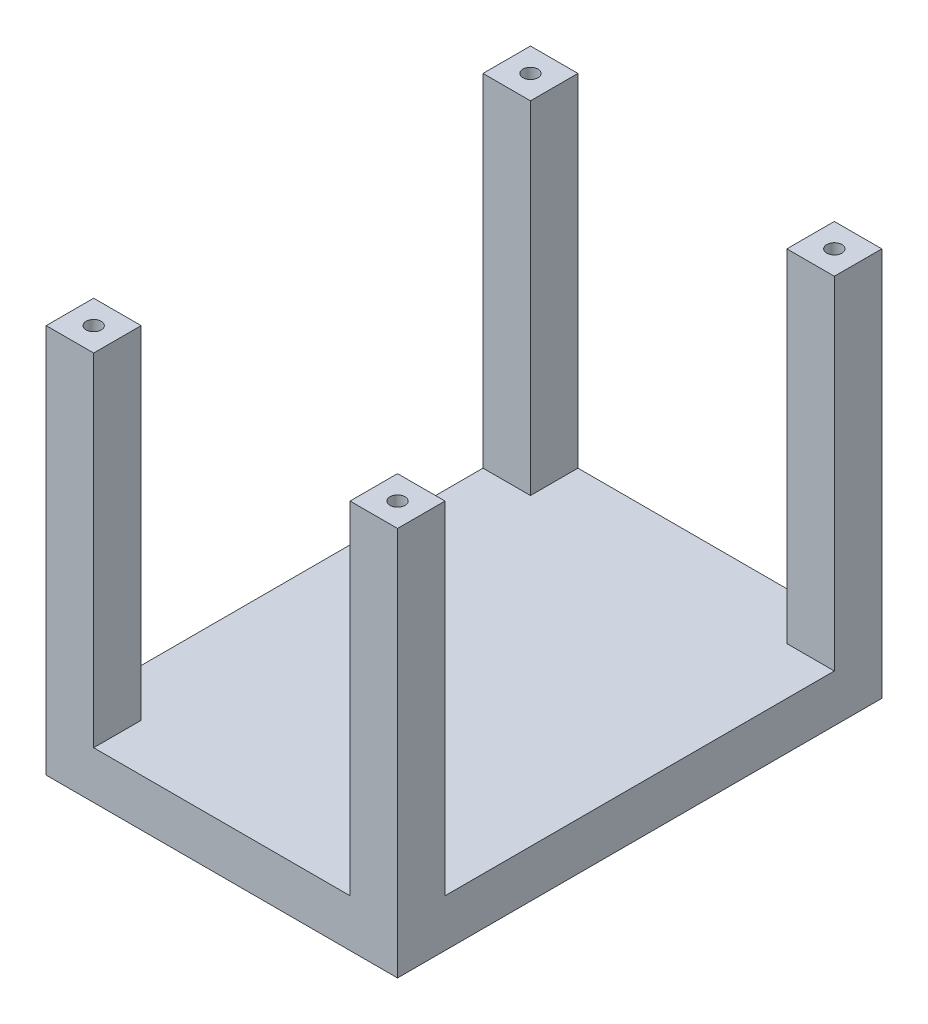
from build123d import *

# Parameters (mm, degrees)
CROQUIS1_W                = 5
CROQUIS1_H                = 5
SALIENTE_EXTRUIR1_DEPTH   = 41
SALIENTE_EXTRUIR1_2_DEPTH = 41
SALIENTE_EXTRUIR1_3_DEPTH = 41
SALIENTE_EXTRUIR1_4_DEPTH = 41
CROQUIS2_W                = 37
CROQUIS2_H                = 51
SALIENTE_EXTRUIR2_DEPTH   = 5
CROQUIS3_R                = 0.79375
CORTAR_EXTRUIR1_DEPTH     = 41


with BuildPart() as part:
    # Croquis1 → Saliente-Extruir1 (new body)
    with BuildSketch(Plane(origin=(0, 0, 0), x_dir=(1, 0, 0), z_dir=(0, 1, 0))):
        with Locations((-18.565940407, 9.143956682)):
            Rectangle(CROQUIS1_W, CROQUIS1_H)
    extrude(amount=SALIENTE_EXTRUIR1_DEPTH)



with BuildPart() as body_2:
    # Croquis1 → Saliente-Extruir1 2 (new body)
    with BuildSketch(Plane(origin=(0, 0, 0), x_dir=(1, 0, 0), z_dir=(0, 1, 0))):
        with Locations((13.434059593, 9.143956682)):
            Rectangle(CROQUIS1_W, CROQUIS1_H)
    extrude(amount=SALIENTE_EXTRUIR1_2_DEPTH)


with BuildPart() as body_3:
    # Croquis1 → Saliente-Extruir1 3 (new body)
    with BuildSketch(Plane(origin=(0, 0, 0), x_dir=(1, 0, 0), z_dir=(0, 1, 0))):
        with Locations((-18.565940407, -36.856043318)):
            Rectangle(CROQUIS1_W, CROQUIS1_H)
    extrude(amount=SALIENTE_EXTRUIR1_3_DEPTH)


with BuildPart() as body_4:
    # Croquis1 → Saliente-Extruir1 4 (new body)
    with BuildSketch(Plane(origin=(0, 0, 0), x_dir=(1, 0, 0), z_dir=(0, 1, 0))):
        with Locations((13.434059593, -36.856043318)):
            Rectangle(CROQUIS1_W, CROQUIS1_H)
    extrude(amount=SALIENTE_EXTRUIR1_4_DEPTH)


with BuildPart() as part_1:
    add(part.part)

    add(body_2.part)  # Saliente-Extruir2 merges body 2

    add(body_3.part)  # Saliente-Extruir2 merges body 3

    add(body_4.part)  # Saliente-Extruir2 merges body 4
    # Croquis2 → Saliente-Extruir2 (add)
    with BuildSketch(Plane(origin=(0, 0, 0), x_dir=(1, 0, 0), z_dir=(0, 1, 0))):
        with Locations((-2.565940407, -13.856043318)):
            Rectangle(CROQUIS2_W, CROQUIS2_H)
    extrude(amount=SALIENTE_EXTRUIR2_DEPTH)

    # Croquis3 → Cortar-Extruir1 (cut)
    with BuildSketch(Plane(origin=(0, 41, 0), x_dir=(1, 0, 0), z_dir=(0, 1, 0))):
        with Locations((-18.565940407, 9.143956682)):
            Circle(CROQUIS3_R)
        with Locations((-18.565940407, -36.856043318)):
            Circle(CROQUIS3_R)
        with Locations((13.434059593, -36.856043318)):
            Circle(CROQUIS3_R)
        with Locations((13.434059593, 9.143956682)):
            Circle(CROQUIS3_R)
    extrude(amount=-CORTAR_EXTRUIR1_DEPTH, mode=Mode.SUBTRACT)


solid = part_1.part
